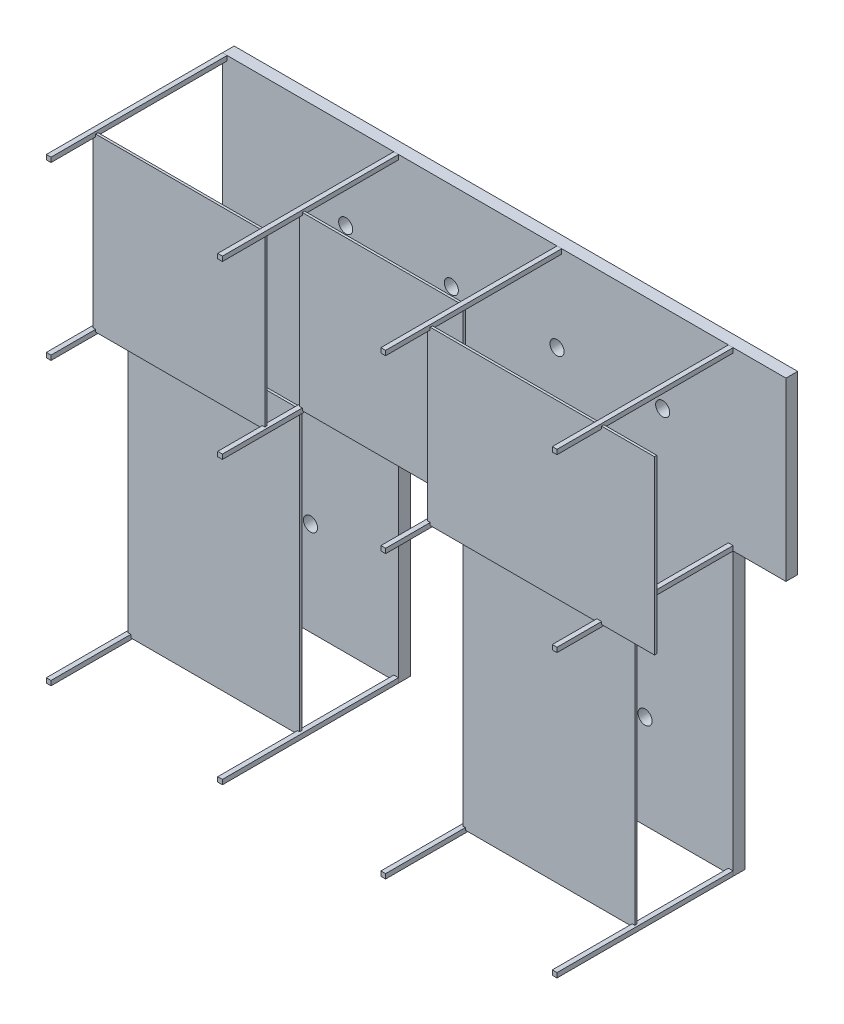
from build123d import *

# Parameters (mm, degrees)
SKETCH1_R              = 60
BOSS_EXTRUDE1_DEPTH    = 100
SKETCH2_W              = 40
SKETCH2_H              = 40
BOSS_EXTRUDE2_DEPTH    = 1500
BOSS_EXTRUDE2_2_DEPTH  = 1500
BOSS_EXTRUDE2_3_DEPTH  = 1500
BOSS_EXTRUDE2_4_DEPTH  = 1500
BOSS_EXTRUDE2_5_DEPTH  = 1500
BOSS_EXTRUDE2_6_DEPTH  = 1500
BOSS_EXTRUDE2_7_DEPTH  = 1500
BOSS_EXTRUDE2_8_DEPTH  = 1500
BOSS_EXTRUDE2_9_DEPTH  = 1500
BOSS_EXTRUDE2_10_DEPTH = 1500
BOSS_EXTRUDE2_11_DEPTH = 1500
BOSS_EXTRUDE2_12_DEPTH = 1500
SKETCH5_W              = 1464.914680954
SKETCH5_H              = 1460.602204205
SKETCH5_W_2            = 1931.254962966
SKETCH5_H_2            = 1462.971886732
BOSS_EXTRUDE5_DEPTH    = 20
SKETCH3_W              = 1460.142152684
SKETCH3_H              = 2406.089345402
SKETCH3_W_2            = 1393.373517389
SKETCH3_H_2            = 1462.042486102
SKETCH3_W_3            = 1462.322698413
SKETCH3_H_3            = 2400.049528254
BOSS_EXTRUDE6_DEPTH    = 20


with BuildPart() as part:
    # Sketch1 → Boss-Extrude1 (new body)
    with BuildSketch(Plane.XY):
        Polygon((0, 0), (0, 3900), (4800, 3900), (4800, 2400), (4350, 2400), (4350, 0), (2850, 0), (2850, 2400), (1500, 2400), (1500, 0), align=None)
        with Locations((1050, 3150)):
            Circle(SKETCH1_R, mode=Mode.SUBTRACT)
        with Locations((1950, 3150)):
            Circle(SKETCH1_R, mode=Mode.SUBTRACT)
        with Locations((2850, 3150)):
            Circle(SKETCH1_R, mode=Mode.SUBTRACT)
        with Locations((750, 800)):
            Circle(SKETCH1_R, mode=Mode.SUBTRACT)
        with Locations((3600, 800)):
            Circle(SKETCH1_R, mode=Mode.SUBTRACT)
        with Locations((3600, 1700)):
            Circle(SKETCH1_R, mode=Mode.SUBTRACT)
        with Locations((750, 1700)):
            Circle(SKETCH1_R, mode=Mode.SUBTRACT)
        with Locations((3750, 3150)):
            Circle(SKETCH1_R, mode=Mode.SUBTRACT)
        with Locations((750, 2600)):
            Circle(SKETCH1_R, mode=Mode.SUBTRACT)
        with Locations((3600, 2600)):
            Circle(SKETCH1_R, mode=Mode.SUBTRACT)
    extrude(amount=BOSS_EXTRUDE1_DEPTH)


with BuildPart() as body_2:
    # Sketch2 → Boss-Extrude2 (new body)
    with BuildSketch(Plane.XY.offset(100)):
        with Locations((4330, 2420)):
            Rectangle(SKETCH2_W, SKETCH2_H)
    extrude(amount=BOSS_EXTRUDE2_DEPTH)



with BuildPart() as body_3:
    # Sketch2 → Boss-Extrude2 2 (new body)
    with BuildSketch(Plane.XY.offset(100)):
        with Locations((4330, 20)):
            Rectangle(SKETCH2_W, SKETCH2_H)
    extrude(amount=BOSS_EXTRUDE2_2_DEPTH)


with BuildPart() as body_4:
    # Sketch2 → Boss-Extrude2 3 (new body)
    with BuildSketch(Plane.XY.offset(100)):
        with Locations((2870, 20)):
            Rectangle(SKETCH2_W, SKETCH2_H)
    extrude(amount=BOSS_EXTRUDE2_3_DEPTH)


with BuildPart() as body_5:
    # Sketch2 → Boss-Extrude2 4 (new body)
    with BuildSketch(Plane.XY.offset(100)):
        with Locations((4330, 3880)):
            Rectangle(SKETCH2_W, SKETCH2_H)
    extrude(amount=BOSS_EXTRUDE2_4_DEPTH)


with BuildPart() as body_6:
    # Sketch2 → Boss-Extrude2 5 (new body)
    with BuildSketch(Plane.XY.offset(100)):
        with Locations((2870, 3880)):
            Rectangle(SKETCH2_W, SKETCH2_H)
    extrude(amount=BOSS_EXTRUDE2_5_DEPTH)


with BuildPart() as body_7:
    # Sketch2 → Boss-Extrude2 6 (new body)
    with BuildSketch(Plane.XY.offset(100)):
        with Locations((1480, 3880)):
            Rectangle(SKETCH2_W, SKETCH2_H)
    extrude(amount=BOSS_EXTRUDE2_6_DEPTH)


with BuildPart() as body_8:
    # Sketch2 → Boss-Extrude2 7 (new body)
    with BuildSketch(Plane.XY.offset(100)):
        with Locations((20, 3880)):
            Rectangle(SKETCH2_W, SKETCH2_H)
    extrude(amount=BOSS_EXTRUDE2_7_DEPTH)


    add(body_7.part)  # Boss-Extrude5 merges body 7

    add(body_5.part)  # Boss-Extrude5 merges body 5

    add(body_6.part)  # Boss-Extrude5 merges body 6
    # Sketch5 → Boss-Extrude5 (add)
    with BuildSketch(Plane.XY.offset(1200)):
        with Locations((748.808177736, 3150.301102103)):
            Rectangle(SKETCH5_W, SKETCH5_H)
        with Locations((3834.372518517, 3149.116260839)):
            Rectangle(SKETCH5_W_2, SKETCH5_H_2)
    extrude(amount=BOSS_EXTRUDE5_DEPTH)


with BuildPart() as body_9:
    # Sketch2 → Boss-Extrude2 8 (new body)
    with BuildSketch(Plane.XY.offset(100)):
        with Locations((20, 2420)):
            Rectangle(SKETCH2_W, SKETCH2_H)
    extrude(amount=BOSS_EXTRUDE2_8_DEPTH)


with BuildPart() as body_10:
    # Sketch2 → Boss-Extrude2 9 (new body)
    with BuildSketch(Plane.XY.offset(100)):
        with Locations((20, 20)):
            Rectangle(SKETCH2_W, SKETCH2_H)
    extrude(amount=BOSS_EXTRUDE2_9_DEPTH)


with BuildPart() as body_11:
    # Sketch2 → Boss-Extrude2 10 (new body)
    with BuildSketch(Plane.XY.offset(100)):
        with Locations((1480, 20)):
            Rectangle(SKETCH2_W, SKETCH2_H)
    extrude(amount=BOSS_EXTRUDE2_10_DEPTH)


with BuildPart() as body_12:
    # Sketch2 → Boss-Extrude2 11 (new body)
    with BuildSketch(Plane.XY.offset(100)):
        with Locations((1480, 2420)):
            Rectangle(SKETCH2_W, SKETCH2_H)
    extrude(amount=BOSS_EXTRUDE2_11_DEPTH)


with BuildPart() as body_13:
    # Sketch2 → Boss-Extrude2 12 (new body)
    with BuildSketch(Plane.XY.offset(100)):
        with Locations((2870, 2420)):
            Rectangle(SKETCH2_W, SKETCH2_H)
    extrude(amount=BOSS_EXTRUDE2_12_DEPTH)


with BuildPart() as body_2_1:
    add(body_2.part)

    add(body_3.part)  # Boss-Extrude6 merges body 3

    add(body_4.part)  # Boss-Extrude6 merges body 4

    add(body_8.part)  # Boss-Extrude6 merges body 8

    add(body_9.part)  # Boss-Extrude6 merges body 9

    add(body_10.part)  # Boss-Extrude6 merges body 10

    add(body_11.part)  # Boss-Extrude6 merges body 11

    add(body_12.part)  # Boss-Extrude6 merges body 12

    add(body_13.part)  # Boss-Extrude6 merges body 13
    # Sketch3 → Boss-Extrude6 (add)
    with BuildSketch(Plane.XY.offset(900)):
        with Locations((747.147288346, 1217.004855553)):
            Rectangle(SKETCH3_W, SKETCH3_H)
        with Locations((2173.905123383, 3151.070771305)):
            Rectangle(SKETCH3_W_2, SKETCH3_H_2)
        with Locations((3601.753231284, 1220.024764127)):
            Rectangle(SKETCH3_W_3, SKETCH3_H_3)
    extrude(amount=BOSS_EXTRUDE6_DEPTH)


solid = Compound([part.part, body_2_1.part])
